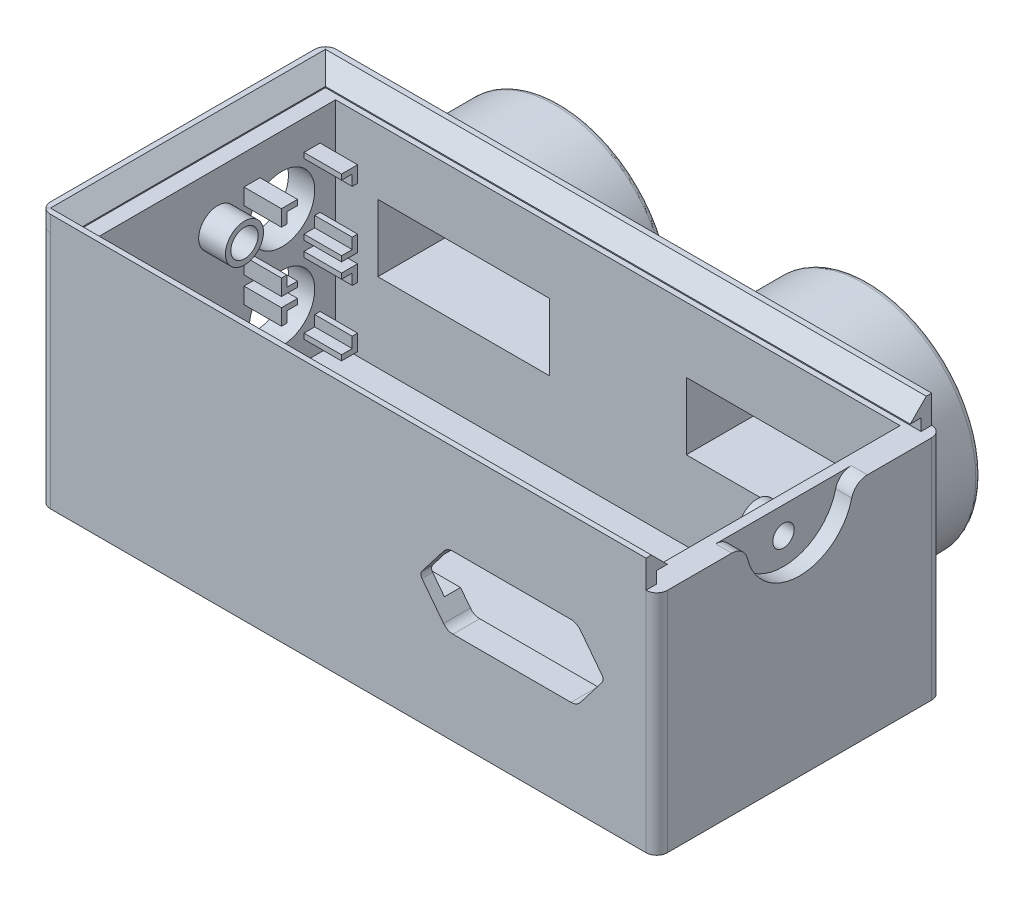
from build123d import *
from OCP.BRepAlgoAPI import BRepAlgoAPI_Cut
from OCP.TopTools import TopTools_ListOfShape

# Parameters (mm, degrees)
SKETCH1_W            = 115.1
SKETCH1_H            = 51.3
BOSS_EXTRUDE1_DEPTH  = 3
SKETCH2_W            = 115.1
SKETCH2_H            = 51.3
SKETCH2_W_2          = 105.3
SKETCH2_H_2          = 45.3
BOSS_EXTRUDE2_DEPTH  = 45
SKETCH5_R            = 21
SKETCH5_W            = 32
SKETCH5_H            = 12.5
BOSS_EXTRUDE4_DEPTH  = 15
SKETCH10_W           = 115.1
SKETCH10_H           = 48
BOSS_EXTRUDE7_DEPTH  = 2
SKETCH11_W           = 32
SKETCH11_H           = 12.5
CUT_EXTRUDE1_DEPTH   = 12
SKETCH12_W           = 37
SKETCH12_H           = 15.2
CUT_EXTRUDE2_DEPTH   = 3
FILLET1_R            = 1
FILLET2_R            = 2
SKETCH14_R           = 6.1
SKETCH14_R_2         = 2.55
CUT_EXTRUDE4_DEPTH   = 5
SKETCH16_R           = 3.55
CUT_EXTRUDE5_DEPTH   = 1
SKETCH18_R           = 3.55
SKETCH18_R_2         = 2.55
BOSS_EXTRUDE9_DEPTH  = 5
CUT_EXTRUDE6_DEPTH   = 5
BOSS_EXTRUDE10_DEPTH = 7
BOSS_EXTRUDE11_DEPTH = 2
SKETCH28_W           = 49.3
SKETCH28_H           = 2.2
CUT_EXTRUDE9_DEPTH   = 113.1
SKETCH29_W           = 4.9
SKETCH29_H           = 45.3
CUT_EXTRUDE11_DEPTH  = 5.6
CUT_EXTRUDE12_START  = -5.6
SKETCH33_W           = 2
SKETCH33_H           = 53.3
CUT_EXTRUDE12_DEPTH  = 5.6
SKETCH34_R           = 10
CUT_EXTRUDE13_DEPTH  = 3
FILLET3_R            = 3
SKETCH35_R           = 2
CUT_EXTRUDE14_DEPTH  = 3
SKETCH37_R           = 3.5
SKETCH37_R_2         = 2
BOSS_EXTRUDE13_DEPTH = 3
FILLET5_R            = 1
SKETCH43_W           = 108.2
SKETCH43_H           = 3.4
BOSS_EXTRUDE14_DEPTH = 2
SKETCH41_W           = 53.3
SKETCH41_H           = 3.4
CUT_EXTRUDE16_DEPTH  = 130.414189717
FILLET7_R            = 2


with BuildPart() as part:
    # Sketch1 → Boss-Extrude1 (new body)
    with BuildSketch(Plane(origin=(0, 0, 0), x_dir=(1, 0, 0), z_dir=(0, 1, 0))):
        Rectangle(SKETCH1_W, SKETCH1_H)
    extrude(amount=BOSS_EXTRUDE1_DEPTH)

    # Sketch2 → Boss-Extrude2 (add)
    with BuildSketch(Plane(origin=(0, 3, 0), x_dir=(1, 0, 0), z_dir=(0, 1, 0))):
        Rectangle(SKETCH2_W, SKETCH2_H)
        Rectangle(SKETCH2_W_2, SKETCH2_H_2, mode=Mode.SUBTRACT)
    extrude(amount=BOSS_EXTRUDE2_DEPTH)

    # Sketch5 → Boss-Extrude4 (add)
    # profile 1 of 2: a face of its own
    with BuildSketch(Plane(origin=(0, 0, -25.65), x_dir=(-1, 0, 0), z_dir=(0, 0, -1))):
        with Locations((-28.775, 24)):
            Circle(SKETCH5_R)
        with Locations((-28.775, 24)):
            Rectangle(SKETCH5_W, SKETCH5_H, mode=Mode.SUBTRACT)
    # profile 2 of 2: a face of its own
    with BuildSketch(Plane(origin=(0, 0, -25.65), x_dir=(-1, 0, 0), z_dir=(0, 0, -1))):
        with Locations(Location((28.775, 24, 0), (0, 0, 180))):
            Circle(SKETCH5_R)
        with Locations((28.775, 24)):
            Rectangle(SKETCH5_W, SKETCH5_H, mode=Mode.SUBTRACT)
    extrude(amount=BOSS_EXTRUDE4_DEPTH)

    # Sketch10 → Boss-Extrude7 (add)
    with BuildSketch(Plane.XY.offset(25.65)):
        with Locations((0, 24)):
            Rectangle(SKETCH10_W, SKETCH10_H)
    extrude(amount=BOSS_EXTRUDE7_DEPTH)

    # Sketch11 → Cut-Extrude1 (cut)
    with BuildSketch(Plane(origin=(0, 0, -25.65), x_dir=(-1, 0, 0), z_dir=(0, 0, -1))):
        with Locations((28.775, 24)):
            Rectangle(SKETCH11_W, SKETCH11_H)
        with Locations((-28.775, 24)):
            Rectangle(SKETCH11_W, SKETCH11_H)
    extrude(amount=-CUT_EXTRUDE1_DEPTH, mode=Mode.SUBTRACT)

    # Sketch12 → Cut-Extrude2 (cut)
    with BuildSketch(Plane(origin=(0, 0, -40.65), x_dir=(-1, 0, 0), z_dir=(0, 0, -1))):
        with Locations((-28.775, 24)):
            Rectangle(SKETCH12_W, SKETCH12_H)
        with Locations((28.775, 24)):
            Rectangle(SKETCH12_W, SKETCH12_H)
    extrude(amount=-CUT_EXTRUDE2_DEPTH, mode=Mode.SUBTRACT)

    # Fillet1
    fillet1_edges = [part.edges().sort_by_distance(p)[0] for p in [
        (49.775, 24, -25.65),
        (-49.775, 24, -25.65),
    ]]
    fillet(fillet1_edges, radius=FILLET1_R)
    fillet1_2_edges = [part.edges().sort_by_distance(p)[0] for p in [
        (49.775, 24, -40.65),
        (-49.775, 24, -40.65),
    ]]
    fillet(fillet1_2_edges, radius=FILLET1_R - 0.0004)  # a hair under: the kernel refuses the full size

    # Fillet2
    fillet2_edges = [part.edges().sort_by_distance(p)[0] for p in [
        (-57.55, 24, 27.65),
        (57.55, 24, 27.65),
        (-57.55, 24, -25.65),
        (57.55, 24, -25.65),
    ]]
    fillet(fillet2_edges, radius=FILLET2_R)

    # Sketch14 → Cut-Extrude4 (cut)
    with BuildSketch(Plane.ZY.offset(57.55)):
        with Locations((-12.65, 29.75)):
            Circle(SKETCH14_R)
        with Locations(Location((-12.65, 13.75, 0), (0, 0, 180))):
            Circle(SKETCH14_R)
        with Locations((-0.65, 32.75)):
            Circle(SKETCH14_R_2)
    extrude(amount=-CUT_EXTRUDE4_DEPTH, mode=Mode.SUBTRACT)

    # Sketch16 → Cut-Extrude5 (cut)
    with BuildSketch(Plane.ZY.offset(57.55)):
        with Locations((-0.65, 32.75)):
            Circle(SKETCH16_R)
    extrude(amount=-CUT_EXTRUDE5_DEPTH, mode=Mode.SUBTRACT)

    # Sketch18 → Boss-Extrude9 (add)
    with BuildSketch(Plane(origin=(-52.65, 0, 0), x_dir=(0, 0, -1), z_dir=(1, 0, 0))):
        with Locations(Location((0.65, 32.75, 0), (0, 0, 180))):
            Circle(SKETCH18_R)
        with Locations(Location((0.65, 32.75, 0), (0, 0, 180))):
            Circle(SKETCH18_R_2, mode=Mode.SUBTRACT)
    extrude(amount=BOSS_EXTRUDE9_DEPTH)

    # Sketch17 → Cut-Extrude6 (cut)
    with BuildSketch(Plane.XY.offset(27.65)):
        with BuildLine():
            Line((15.951519701, 20.55), (17.791030219, 18.158636326))
            ThreePointArc((17.791030219, 18.158636326), (18.562949118, 17.526297884), (19.534802995, 17.3))
            Line((19.534802995, 17.3), (41.565197005, 17.3))
            ThreePointArc((41.565197005, 17.3), (42.537050882, 17.526297884), (43.308969781, 18.158636326))
            Line((43.308969781, 18.158636326), (45.148480299, 20.55))
            Line((45.148480299, 20.55), (52.25, 20.55))
            Line((52.25, 20.55), (52.25, 27.45))
            Line((52.25, 27.45), (45.148480299, 27.45))
            Line((45.148480299, 27.45), (43.308969781, 29.841363674))
            ThreePointArc((43.308969781, 29.841363674), (42.537050882, 30.473702116), (41.565197005, 30.7))
            Line((41.565197005, 30.7), (19.534802995, 30.7))
            ThreePointArc((19.534802995, 30.7), (18.562949118, 30.473702116), (17.791030219, 29.841363674))
            Line((17.791030219, 29.841363674), (15.951519701, 27.45))
            Line((15.951519701, 27.45), (8.85, 27.45))
            Line((8.85, 27.45), (8.85, 20.55))
            Line((8.85, 20.55), (15.951519701, 20.55))
        make_face()
    extrude(amount=-CUT_EXTRUDE6_DEPTH, mode=Mode.SUBTRACT)

    # Sketch23 → Boss-Extrude10 (add)
    with BuildSketch(Plane(origin=(-52.65, 0, 0), x_dir=(0, 0, -1), z_dir=(1, 0, 0))):
        Polygon((5.55, 33.85), (6.55, 33.85), (6.55, 35.85), (8.55, 35.85), (8.55, 36.85), (5.55, 36.85), align=None)
        Polygon((6.55, 23.65), (8.55, 23.65), (8.55, 22.65), (5.55, 22.65), (5.55, 25.65), (6.55, 25.65), align=None)
        Polygon((18.75, 35.85), (18.75, 33.85), (19.75, 33.85), (19.75, 36.85), (16.75, 36.85), (16.75, 35.85), align=None)
        Polygon((16.75, 22.65), (16.75, 23.65), (18.75, 23.65), (18.75, 25.65), (19.75, 25.65), (19.75, 22.65), align=None)
        Polygon((19.75, 6.65), (19.75, 9.65), (18.75, 9.65), (18.75, 7.65), (16.75, 7.65), (16.75, 6.65), align=None)
        Polygon((5.55, 20.85), (8.55, 20.85), (8.55, 19.85), (6.55, 19.85), (6.55, 17.85), (5.55, 17.85), align=None)
        Polygon((5.55, 6.65), (5.55, 9.65), (6.55, 9.65), (6.55, 7.65), (8.55, 7.65), (8.55, 6.65), align=None)
        Polygon((16.75, 20.85), (16.75, 19.85), (18.75, 19.85), (18.75, 17.85), (19.75, 17.85), (19.75, 20.85), align=None)
    extrude(amount=BOSS_EXTRUDE10_DEPTH)

    # Sketch25 → Boss-Extrude11 (add)
    with BuildSketch(Plane.XY.offset(27.65)):
        with BuildLine():
            Line((15.951519701, 27.45), (13.766681824, 24.609710761))
            ThreePointArc((13.766681824, 24.609710761), (13.559305813, 24), (13.766681824, 23.390289239))
            Line((13.766681824, 23.390289239), (15.951519701, 20.55))
            Line((15.951519701, 20.55), (8.85, 20.55))
            Line((8.85, 20.55), (8.85, 27.45))
            Line((8.85, 27.45), (15.951519701, 27.45))
        make_face()
        with BuildLine():
            Line((45.148480299, 27.45), (47.333318176, 24.609710761))
            ThreePointArc((47.333318176, 24.609710761), (47.540694187, 24), (47.333318176, 23.390289239))
            Line((47.333318176, 23.390289239), (45.148480299, 20.55))
            Line((45.148480299, 20.55), (52.25, 20.55))
            Line((52.25, 20.55), (52.25, 27.45))
            Line((52.25, 27.45), (45.148480299, 27.45))
        make_face()
    extrude(amount=-BOSS_EXTRUDE11_DEPTH)

    # Sketch28 → Cut-Extrude9 (cut)
    with BuildSketch(Plane(origin=(57.55, 0, 0), x_dir=(0, 0, -1), z_dir=(1, 0, 0))):
        with Locations((-1, 43.5)):
            Rectangle(SKETCH28_W, SKETCH28_H)
    extrude(amount=-CUT_EXTRUDE9_DEPTH, mode=Mode.SUBTRACT)

    # Sketch29 → Cut-Extrude11 (cut)
    with BuildSketch(Plane(origin=(0, 48, 0), x_dir=(1, 0, 0), z_dir=(0, 1, 0))):
        with Locations((55.1, 0)):
            Rectangle(SKETCH29_W, SKETCH29_H)
    extrude(amount=-CUT_EXTRUDE11_DEPTH, mode=Mode.SUBTRACT)


with BuildPart() as cut_extrude12_tool:
    # Sketch33 → Cut-Extrude12 (new body)
    with BuildSketch(Plane(origin=(0, 48, 0), x_dir=(1, 0, 0), z_dir=(0, 1, 0)).offset(CUT_EXTRUDE12_START)):
        with Locations((56.55, -1)):
            Rectangle(SKETCH33_W, SKETCH33_H)
    extrude(amount=CUT_EXTRUDE12_DEPTH)


with BuildPart() as part_1:
    add(part.part)

    # Cut-Extrude12: cut by cut_extrude12_tool, with a tolerance
    cut_extrude12_stock = TopTools_ListOfShape()
    cut_extrude12_stock.Append(part_1.part.wrapped)
    cut_extrude12_tools = TopTools_ListOfShape()
    cut_extrude12_tools.Append(cut_extrude12_tool.part.wrapped)
    cut_extrude12_cut = BRepAlgoAPI_Cut()
    cut_extrude12_cut.SetArguments(cut_extrude12_stock)
    cut_extrude12_cut.SetTools(cut_extrude12_tools)
    cut_extrude12_cut.SetFuzzyValue(0.00001)
    cut_extrude12_cut.Build()
    add(Compound.cast(cut_extrude12_cut.Shape()).solids(), mode=Mode.REPLACE)

    # Sketch34 → Cut-Extrude13 (cut)
    with BuildSketch(Plane(origin=(57.55, 0, 0), x_dir=(0, 0, -1), z_dir=(1, 0, 0))):
        with Locations((-1, 42.4)):
            Circle(SKETCH34_R)
    extrude(amount=-CUT_EXTRUDE13_DEPTH, mode=Mode.SUBTRACT)

    # Fillet3
    fillet3_edges = [part_1.edges().sort_by_distance(p)[0] for p in [
        (56.05, 42.4, 11),
        (56.05, 42.4, -9),
    ]]
    fillet(fillet3_edges, radius=FILLET3_R)

    # Sketch35 → Cut-Extrude14 (cut)
    with BuildSketch(Plane(origin=(54.55, 0, 0), x_dir=(0, 0, -1), z_dir=(1, 0, 0))):
        with Locations((-1, 37.4)):
            Circle(SKETCH35_R)
    extrude(amount=-CUT_EXTRUDE14_DEPTH, mode=Mode.SUBTRACT)

    # Sketch37 → Boss-Extrude13 (add)
    with BuildSketch(Plane.ZY.offset(-52.65)):
        with Locations((1, 37.4)):
            Circle(SKETCH37_R)
        with Locations(Location((1, 37.4, 0), (0, 0, 180))):
            Circle(SKETCH37_R_2, mode=Mode.SUBTRACT)
    extrude(amount=BOSS_EXTRUDE13_DEPTH)

    # Fillet5
    fillet5_edges = [part_1.edges().sort_by_distance(p)[0] for p in [
        (52.65, 37.4, -2.5),
    ]]
    fillet(fillet5_edges, radius=FILLET5_R)

    # Sketch43 → Boss-Extrude14 (add)
    with BuildSketch(Plane.XY.offset(-22.65)):
        with Locations((1.45, 46.3)):
            Rectangle(SKETCH43_W, SKETCH43_H)
    extrude(amount=BOSS_EXTRUDE14_DEPTH)

    # Sketch41 → Cut-Extrude16 (cut, through all)
    with BuildSketch(Plane(origin=(55.55, 0, 0), x_dir=(0, 0, -1), z_dir=(1, 0, 0))):
        with Locations((-1, 46.3)):
            Rectangle(SKETCH41_W, SKETCH41_H)
    extrude(amount=-CUT_EXTRUDE16_DEPTH, mode=Mode.SUBTRACT)

    # Sweep2: sweep along a path in Sketch44
    with BuildLine(Plane(origin=(0, 44.6, 0), x_dir=(1, 0, 0), z_dir=(0, 1, 0))) as sweep2_path:
        Line((55.55, 23.65), (-55.55, 23.65))
        Line((-55.55, 23.65), (-55.55, -25.65))
        Line((-55.55, -25.65), (55.55, -25.65))
    # Sketch42 → Sweep2 (sweep)
    with BuildSketch(Plane(origin=(55.55, 0, 0), x_dir=(0, 0, -1), z_dir=(1, 0, 0))):
        Polygon((-27.65, 44.6), (-27.65, 47.6), (-26.65, 47.6), (-23.65, 44.6), align=None)
    sweep(path=sweep2_path.line, transition=Transition.RIGHT)

    # Fillet7
    fillet7_edges = [part_1.edges().sort_by_distance(p)[0] for p in [
        (-57.55, 46.1, 27.65),
        (-57.55, 46.1, -25.65),
    ]]
    fillet(fillet7_edges, radius=FILLET7_R)


solid = part_1.part
